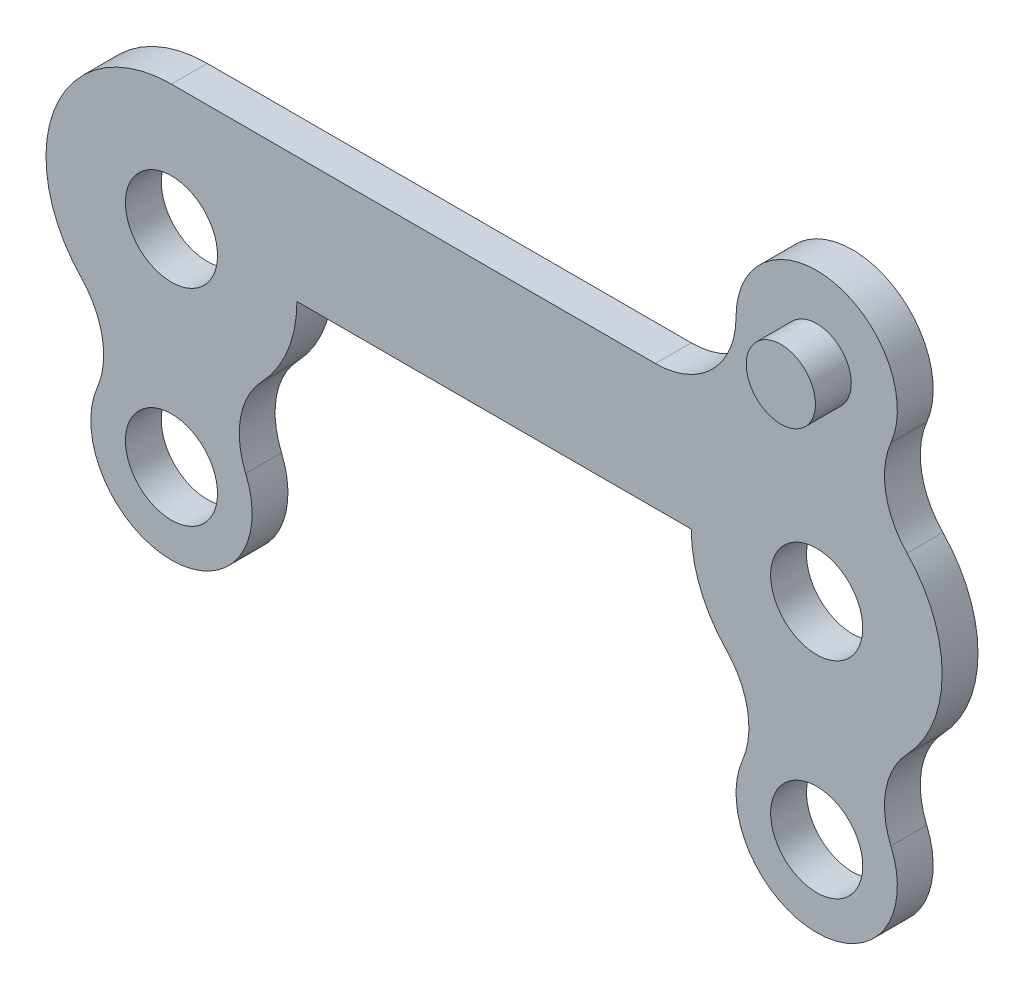
from build123d import *

# Parameters (mm, degrees)
SKETCH2_R           = 2.0399375
SKETCH2_R_2         = 1.5319375
BOSS_EXTRUDE1_DEPTH = 1.5875
SKETCH2_4_R         = 1.5319375
BOSS_EXTRUDE3_DEPTH = 3.175


with BuildPart() as part:
    # Sketch2 → Boss-Extrude1 (new body)
    with BuildSketch(Plane.XY):
        with BuildLine():
            Line((21.43125, 5.55625), (0, 5.55625))
            ThreePointArc((0, 5.55625), (-5.113202022, 2.174184709), (-4.001636229, -3.854714199))
            ThreePointArc((-4.001636229, -3.854714199), (-3.061446645, -5.685103398), (-3.287058415, -7.730434766))
            ThreePointArc((-3.287058415, -7.730434766), (0, -12.7), (3.287058415, -7.730434766))
            ThreePointArc((3.287058415, -7.730434766), (3.061446641, -5.685103418), (4.0016362, -3.854714229))
            ThreePointArc((4.0016362, -3.854714229), (5.152960566, -2.078199091), (5.55625, 0))
            Line((5.55625, 0), (23.01875, 0))
            ThreePointArc((23.01875, 0), (23.422039385, -2.07819897), (24.573363619, -3.854714041))
            ThreePointArc((24.573363619, -3.854714041), (25.513553344, -5.685103337), (25.287941547, -7.730434854))
            ThreePointArc((25.287941547, -7.730434854), (28.575000048, -12.7), (31.862058415, -7.730434766))
            ThreePointArc((31.862058415, -7.730434766), (31.636446655, -5.685103342), (32.576636308, -3.854714117))
            ThreePointArc((32.576636308, -3.854714117), (34.13125, -7.3e-08), (32.576636409, 3.854714012))
            ThreePointArc((32.576636409, 3.854714012), (31.636446674, 5.685103241), (31.862058392, 7.730434711))
            ThreePointArc((31.862058392, 7.730434711), (29.288207306, 12.628071622), (25.003125, 9.128125))
            ThreePointArc((25.003125, 9.128125), (23.956947034, 6.602427966), (21.43125, 5.55625))
        make_face()
        Circle(SKETCH2_R, mode=Mode.SUBTRACT)
        with Locations((28.575, 0)):
            Circle(SKETCH2_R, mode=Mode.SUBTRACT)
        with Locations((28.575, 9.128125)):
            Circle(SKETCH2_R_2, mode=Mode.SUBTRACT)
        with Locations((0, -9.128125)):
            Circle(SKETCH2_R, mode=Mode.SUBTRACT)
        with Locations((28.575, -9.128125)):
            Circle(SKETCH2_R, mode=Mode.SUBTRACT)
    extrude(amount=BOSS_EXTRUDE1_DEPTH)

    # Sketch2<4> → Boss-Extrude3 (add)
    with BuildSketch(Plane.XY):
        with Locations((28.575, 9.128125)):
            Circle(SKETCH2_4_R)
    extrude(amount=BOSS_EXTRUDE3_DEPTH)


solid = part.part
